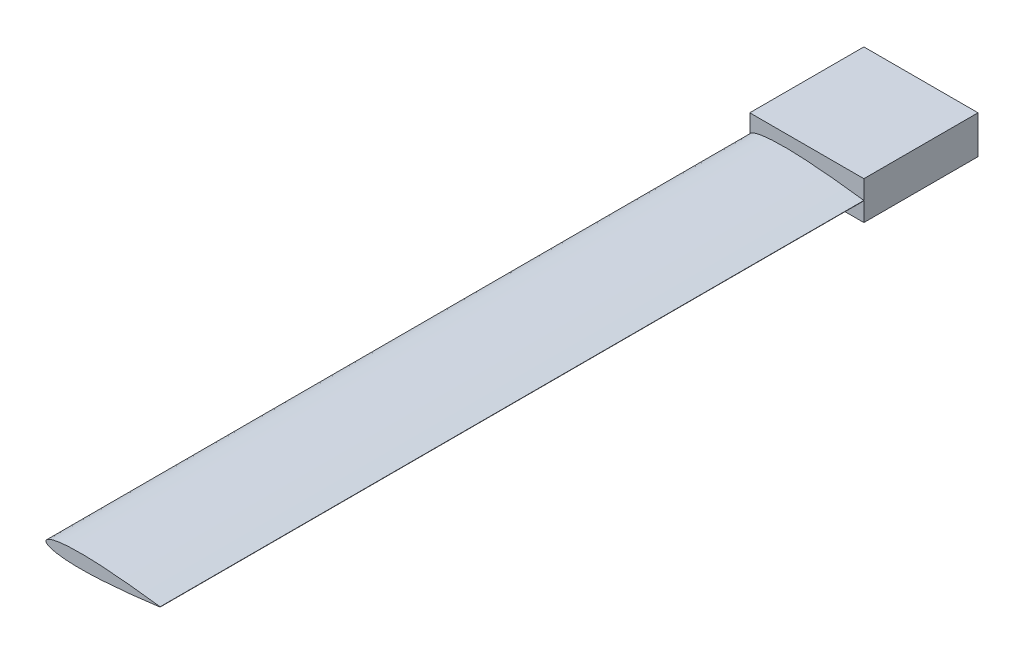
from build123d import *

# Parameters (mm, degrees)
BOSS_EXTRUDE1_DEPTH      = 215
BOSS_EXTRUDE2_DEPTH      = 5
BOSS_EXTRUDE2_DEPTH_BACK = 5
SKETCH3_W                = 30
SKETCH3_H                = 30


with BuildPart() as part:
    # Sketch2 → Boss-Extrude1 (new body)
    with BuildSketch(Plane.XY):
        with BuildLine():
            Line((25.271786489, 0.037718364), (25.271786489, -0.037881636))
            add(Edge.make_bspline(
                [(25.271786489, 0.037718364), (25.265946529, 0.038538651), (25.242607679, 0.041816853), (25.149461492, 0.054844235), (25.010024383, 0.074317374), (24.824583749, 0.099891114), (24.634303463, 0.12605238), (24.410469257, 0.156536466), (24.153611636, 0.191145928), (23.864338887, 0.229732769), (23.543323352, 0.272019957), (23.191313008, 0.317808857), (22.809122697, 0.366731925), (22.241912553, 0.43832186), (21.637567273, 0.512616878), (20.997485164, 0.589247536), (20.479151664, 0.650105615), (19.936960736, 0.712401161), (19.372209546, 0.775975081), (18.786199365, 0.840371325), (18.180317425, 0.905416939), (17.555955055, 0.970647095), (16.914584006, 1.035940912), (16.257694343, 1.100794905), (15.586830599, 1.165005382), (14.903550641, 1.228126374), (14.209448394, 1.289951515), (13.50614921, 1.349969704), (12.795292058, 1.407912487), (12.078546163, 1.463409832), (11.357576372, 1.516016235), (10.634076994, 1.565401752), (9.909736937, 1.6111719), (8.947283182, 1.666660997), (7.989163996, 1.713473952), (6.80620551, 1.759026182), (5.874913692, 1.784678564), (4.956897616, 1.798016436), (4.285987299, 1.801531177), (3.629051572, 1.798424061), (2.987627911, 1.788555389), (2.363219379, 1.771626921), (1.757270389, 1.747713569), (1.171194843, 1.716643509), (0.606357201, 1.678503826), (0.064087527, 1.633302473), (-0.454353434, 1.581121605), (-0.947761068, 1.522159166), (-1.414997877, 1.456654824), (-1.854963163, 1.384730684), (-2.266648608, 1.306746212), (-2.649106725, 1.222994639), (-3.001443678, 1.133759877), (-3.322880912, 1.039441682), (-3.612709659, 0.940353284), (-3.870311843, 0.836836913), (-4.095177529, 0.729191193), (-4.286878319, 0.617640239), (-4.445190983, 0.50237315), (-4.569809621, 0.38320032), (-4.66043371, 0.259784151), (-4.715841421, 0.131521399), (-4.734244186, -8.1636e-05), (-4.715841421, -0.131684671), (-4.66043371, -0.259947423), (-4.569809621, -0.383363592), (-4.445190983, -0.502536422), (-4.286878319, -0.617803511), (-4.095177529, -0.729354465), (-3.870311843, -0.837000185), (-3.612709659, -0.940516556), (-3.322880912, -1.039604954), (-3.001443678, -1.133923149), (-2.649106725, -1.223157911), (-2.266648608, -1.306909484), (-1.854963163, -1.384893956), (-1.414997877, -1.456818096), (-0.947761068, -1.522322438), (-0.454353434, -1.581284877), (0.064087527, -1.633465745), (0.606357201, -1.678667098), (1.171194843, -1.716806781), (1.757270389, -1.747876841), (2.363219379, -1.771790193), (2.987627911, -1.788718661), (3.629051572, -1.798587333), (4.285987299, -1.801694449), (4.956897616, -1.798179708), (5.874913692, -1.784841836), (7.045468196, -1.752598977), (8.228268838, -1.702643205), (9.186232818, -1.653047919), (9.909736937, -1.611335172), (10.634076994, -1.565565024), (11.357576372, -1.516179507), (12.078546163, -1.463573104), (12.795292058, -1.408075759), (13.50614921, -1.350132976), (14.209448394, -1.290114786), (14.903550641, -1.228289646), (15.586830599, -1.165168654), (16.257694343, -1.100958177), (16.914584006, -1.036104184), (17.555955055, -0.970810367), (18.180317425, -0.905580211), (18.786199365, -0.840534597), (19.372209546, -0.776138353), (19.936960736, -0.712564433), (20.479151664, -0.650268887), (20.997485164, -0.589410808), (21.637567273, -0.51278015), (22.241912553, -0.438485132), (22.809122697, -0.366895197), (23.191313008, -0.317972128), (23.543323352, -0.272183229), (23.864338887, -0.22989604), (24.153611636, -0.1913092), (24.410469257, -0.156699738), (24.634303463, -0.126215652), (24.824583749, -0.100054385), (25.010024383, -0.074480646), (25.149461492, -0.055007507), (25.242607679, -0.041980125), (25.265946529, -0.038701923), (25.271786489, -0.037881636)],
                knots=[0, 0, 0, 0, 0.000289201, 0.001155766, 0.004612322, 0.007193518, 0.010335793, 0.014031397, 0.018271612, 0.023045847, 0.028342901, 0.03415012, 0.04045376, 0.04723833, 0.062186613, 0.070313724, 0.078851908, 0.087780126, 0.097077521, 0.106722049, 0.116690868, 0.126960505, 0.137507218, 0.148306055, 0.159330765, 0.17055649, 0.181956531, 0.193504043, 0.205171367, 0.2169323, 0.228758169, 0.2406214, 0.252494936, 0.264350287, 0.287897994, 0.299535854, 0.322404759, 0.333584032, 0.344559266, 0.35530596, 0.365799778, 0.37601757, 0.3859373, 0.395537659, 0.404797976, 0.413698812, 0.422221441, 0.430349273, 0.438066019, 0.445356904, 0.452209372, 0.458611567, 0.464554044, 0.47002985, 0.475034902, 0.479569141, 0.483636857, 0.487250263, 0.490431338, 0.493218828, 0.495674086, 0.497891368, 0.5, 0.502108632, 0.504325914, 0.506781172, 0.509568662, 0.512749737, 0.516363143, 0.520430859, 0.524965098, 0.52997015, 0.535445956, 0.541388433, 0.547790628, 0.554643096, 0.561933981, 0.569650727, 0.577778559, 0.586301188, 0.595202024, 0.604462341, 0.6140627, 0.62398243, 0.634200222, 0.64469404, 0.655440734, 0.666415968, 0.677595241, 0.700464146, 0.723839427, 0.735649713, 0.747505064, 0.7593786, 0.771241831, 0.7830677, 0.794828633, 0.806495957, 0.818043469, 0.82944351, 0.840669235, 0.851693945, 0.862492782, 0.873039495, 0.883309132, 0.893277951, 0.902922479, 0.912219874, 0.921148092, 0.929686276, 0.937813387, 0.95276167, 0.95954624, 0.96584988, 0.971657099, 0.976954153, 0.981728388, 0.985968603, 0.989664207, 0.992806482, 0.995387678, 0.998844234, 0.999710799, 1, 1, 1, 1], degree=3))
        make_face()
    extrude(amount=BOSS_EXTRUDE1_DEPTH)

    # Sketch3 → Boss-Extrude2 (add, two sides: drawn at the far end of the back side and taken through both)
    with BuildSketch(Plane(origin=(0, 0, 0), x_dir=(1, 0, 0), z_dir=(0, 1, 0)).offset(-BOSS_EXTRUDE2_DEPTH_BACK)):
        with Locations((10.271786489, -15)):
            Rectangle(SKETCH3_W, SKETCH3_H)
    extrude(amount=BOSS_EXTRUDE2_DEPTH + BOSS_EXTRUDE2_DEPTH_BACK)


solid = part.part
